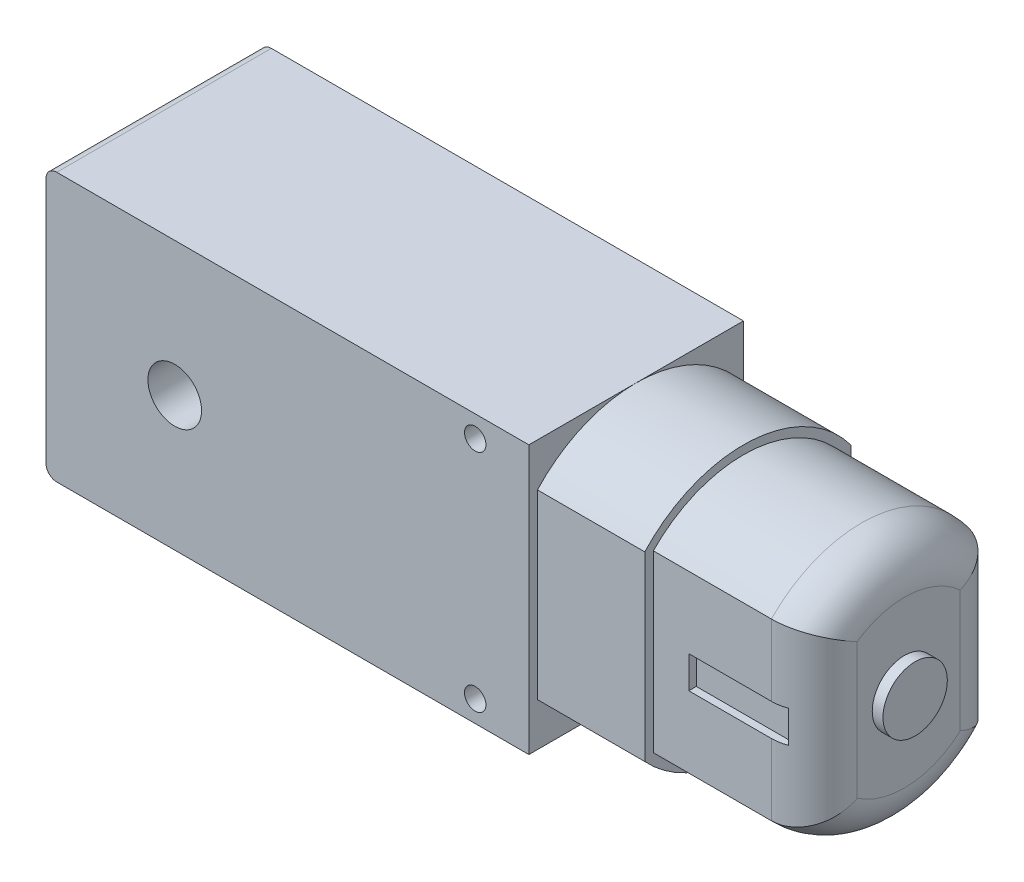
from build123d import *

# Parameters (mm, degrees)
BOSS_EXTRUDE1_DEPTH     = 10
CUT_EXTRUDE2_DEPTH      = 25
SKETCH4_W               = 2.420711262391846
SKETCH4_H               = 16.924538398432034
CUT_EXTRUDE3_DEPTH      = 25
CUT_EXTRUDE4_DEPTH      = 15.000000000000002
FILLET1_R               = 4
SKETCH6_R               = 3
BOSS_EXTRUDE2_DEPTH     = 1
SKETCH7_W               = 9.06468295299787
SKETCH7_H               = 3
CUT_EXTRUDE5_DEPTH      = 1.5
FILLET2_R               = 1
SKETCH8_R               = 1.500000000000004
BOSS_EXTRUDE3_DEPTH     = 1.75
CUT_EXTRUDE7_DEPTH      = 47.435439052516784
CUT_EXTRUDE7_DEPTH_BACK = 47.435439052516784
SKETCH9_R               = 1
SKETCH10_R              = 2.4999999999999982
CUT_EXTRUDE8_DEPTH      = 47.435439052516784


with BuildPart() as part:
    # Sketch1 → Boss-Extrude1 (new, symmetric)
    with BuildSketch(Plane.XY):
        Polygon((34.99999999999999, -12.5), (-35.00000000000001, -12.500000000000005), (-35.00000000000001, 12.499999999999995), (34.99999999999999, 12.500000000000002), align=None)
    extrude(amount=BOSS_EXTRUDE1_DEPTH, both=True)

    # Sketch2 → Cut-Extrude2 (cut)
    with BuildSketch(Plane(origin=(34.99999999999999, 0, 0), x_dir=(0, 0, -1), z_dir=(1, 0, 0))):
        with BuildLine():
            Line((-10, 12.500000000000002), (-10, 7.500000000000002))
            ThreePointArc((-9.999999999999998, 7.500000000000003), (-5.590169943749482, 11.180339887498945), (-1.821e-14, 12.500000000000004))
            Line((-1.776e-14, 12.500000000000002), (-10, 12.500000000000002))
        make_face()
        with BuildLine():
            Line((10, 12.500000000000002), (-1.776e-14, 12.500000000000002))
            ThreePointArc((-1.821e-14, 12.500000000000004), (5.590169943749467, 11.180339887498956), (10, 7.500000000000001))
            Line((10, 7.500000000000002), (10, 12.500000000000002))
        make_face()
        with BuildLine():
            ThreePointArc((9.999999999999998, -7.500000000000003), (5.590169943749469, -11.180339887498953), (-1.554e-14, -12.5))
            Line((-1.599e-14, -12.5), (10, -12.5))
            Line((10, -12.5), (10, -7.500000000000002))
        make_face()
        with BuildLine():
            ThreePointArc((-1.554e-14, -12.5), (-5.590169943749482, -11.180339887498945), (-10, -7.500000000000001))
            Line((-10, -7.500000000000002), (-10, -12.5))
            Line((-10, -12.5), (-1.599e-14, -12.5))
        make_face()
    extrude(amount=-CUT_EXTRUDE2_DEPTH, mode=Mode.SUBTRACT)

    # Sketch4 → Cut-Extrude3 (cut)
    with BuildSketch(Plane(origin=(34.99999999999999, 0, 0), x_dir=(0, 0, -1), z_dir=(1, 0, 0))):
        with Locations((-10.41035563119592, 0)):
            Rectangle(SKETCH4_W, SKETCH4_H)
    extrude(amount=-CUT_EXTRUDE3_DEPTH, mode=Mode.SUBTRACT)

    # Sketch5 → Cut-Extrude4 (cut)
    with BuildSketch(Plane(origin=(34.99999999999999, 0, 0), x_dir=(0, 0, -1), z_dir=(1, 0, 0))):
        with BuildLine():
            Line((-9.199999999999998, 8.462269199216015), (-9.199999999999996, -8.462269199216017))
            ThreePointArc((-9.199999999999996, -8.462269199216017), (0.6256920192394629, -12.484330558626684), (10, -7.500000000000002))
            Line((10, -7.500000000000002), (10, 7.500000000000002))
            ThreePointArc((10, 7.500000000000002), (0.6256920192394629, 12.484330558626686), (-9.199999999999998, 8.462269199216015))
        make_face()
        with BuildLine():
            Line((-8.399999999999997, 8.144323176298942), (-8.399999999999997, -8.144323176298942))
            ThreePointArc((-8.399999999999997, -8.144323176298942), (0.608047219709459, -11.684189256367068), (9.2, -7.228416147400481))
            Line((9.2, -7.228416147400481), (9.2, 7.228416147400481))
            ThreePointArc((9.2, 7.228416147400481), (0.6080472197094615, 11.684189256367066), (-8.399999999999997, 8.144323176298942))
        make_face(mode=Mode.SUBTRACT)
    extrude(amount=-CUT_EXTRUDE4_DEPTH, mode=Mode.SUBTRACT)

    # Fillet1
    # the kernel refuses this fillet: 4 mm, written as the material it takes off along each edge
    with BuildSketch(Plane(origin=(34.99999999999999, -4.44e-15, 6.7e-16), x_dir=(0, -0.1880210929197643, -0.982164990527181), z_dir=(0, -0.982164990527181, 0.1880210929197643))) as fillet1_piece_1:
        with BuildLine():
            CenterArc((11.700000000000003 - FILLET1_R, -FILLET1_R), FILLET1_R, 0, 89.99999999999999)
            Line((11.700000000000003 - FILLET1_R, 0), (11.700000000000003, 0))
            Line((11.700000000000003, 0), (11.700000000000003, -FILLET1_R))
        make_face()
    revolve(axis=Axis((34.99999999999999, -4.44e-15, 6.7e-16), (1, 0, 0)), revolution_arc=195.71664993769073, mode=Mode.SUBTRACT)
    with BuildSketch(Plane(origin=(34.99999999999999, -17.22841614740048, -9.2), x_dir=(-1, 0, 0), z_dir=(0, 1, 0))) as fillet1_piece_2:
        with BuildLine():
            CenterArc((FILLET1_R, FILLET1_R), FILLET1_R, 180, 90)
            Line((0, FILLET1_R), (0, 0))
            Line((0, 0), (FILLET1_R, 0))
        make_face()
    extrude(amount=34.45683229480096, mode=Mode.SUBTRACT)
    with BuildSketch(Plane(origin=(34.99999999999999, 0, 6.7e-16), x_dir=(0, 0.0850574768635666, 0.9963760462945724), z_dir=(0, 0.9963760462945724, -0.0850574768635666))) as fillet1_piece_3:
        with BuildLine():
            CenterArc((11.700000000000003 - FILLET1_R, -FILLET1_R), FILLET1_R, 0, 90)
            Line((11.700000000000003 - FILLET1_R, 0), (11.700000000000003, 0))
            Line((11.700000000000003, 0), (11.700000000000003, -FILLET1_R))
        make_face()
    revolve(axis=Axis((34.99999999999999, 0, 6.7e-16), (1, 0, 0)), revolution_arc=195.71664993769085, mode=Mode.SUBTRACT)
    with BuildSketch(Plane(origin=(34.99999999999999, 18.14432317629894, 8.399999999999997), x_dir=(-1, 0, 0), z_dir=(0, -1, 0))) as fillet1_piece_4:
        with BuildLine():
            CenterArc((FILLET1_R, FILLET1_R), FILLET1_R, 180, 90)
            Line((0, FILLET1_R), (0, 0))
            Line((0, 0), (FILLET1_R, 0))
        make_face()
    extrude(amount=36.28864635259788, mode=Mode.SUBTRACT)

    # Sketch6 → Boss-Extrude2 (add)
    with BuildSketch(Plane(origin=(34.99999999999999, 0, 0), x_dir=(0, 0, -1), z_dir=(1, 0, 0))):
        with Locations(Location((0, 0, 0), (0, 0, 180))):
            Circle(SKETCH6_R)
    extrude(amount=BOSS_EXTRUDE2_DEPTH)

    # Sketch7 → Cut-Extrude5 (cut)
    with BuildSketch(Plane(origin=(0, 0, -9.2), x_dir=(-1, 0, 0), z_dir=(0, 0, -1))):
        with Locations((-27.832741428017933, 0)):
            Rectangle(SKETCH7_W, SKETCH7_H)
    cut_extrude5 = extrude(amount=-CUT_EXTRUDE5_DEPTH, mode=Mode.SUBTRACT)

    # Mirror1: Cut-Extrude5 across plane
    add(cut_extrude5.mirror(Plane.XY), mode=Mode.SUBTRACT)

    # Fillet2
    fillet2_edges = [part.edges().sort_by_distance(p)[0] for p in [
        (-35.00000000000001, 12.499999999999995, 0),
        (-35.00000000000001, -12.500000000000005, 0),
    ]]
    fillet(fillet2_edges, radius=FILLET2_R)

    # Sketch8 → Boss-Extrude3 (add, symmetric)
    with BuildSketch(Plane.XY):
        Polygon((-35.00000000000001, -2.4999999999999987), (-40.00000000000001, -2.499999999999998), (-40.00000000000001, 2.500000000000002), (-35.00000000000001, 2.4999999999999987), align=None)
        with Locations((-37.50000000000001, 2.17e-15)):
            Circle(SKETCH8_R, mode=Mode.SUBTRACT)
    extrude(amount=BOSS_EXTRUDE3_DEPTH, both=True)

    # Sketch9 → Cut-Extrude7 (cut, two sides: drawn at the far end of the back side and taken through both)
    with BuildSketch(Plane.XY.offset(10).offset(-CUT_EXTRUDE7_DEPTH_BACK)):
        with Locations(Location((4.99999999999999, -10.500000000000004, 0), (0, 0, 180))):
            Circle(SKETCH9_R)
        with Locations(Location((4.99999999999999, 10.500000000000004, 0), (0, 0, 180))):
            Circle(SKETCH9_R)
    extrude(amount=CUT_EXTRUDE7_DEPTH + CUT_EXTRUDE7_DEPTH_BACK, mode=Mode.SUBTRACT)

    # Sketch10 → Cut-Extrude8 (cut, through all)
    with BuildSketch(Plane(origin=(0, 0, -10), x_dir=(-1, 0, 0), z_dir=(0, 0, -1))):
        with Locations((23.00000000000001, 0)):
            Circle(SKETCH10_R)
    extrude(amount=-CUT_EXTRUDE8_DEPTH, mode=Mode.SUBTRACT)


solid = part.part
